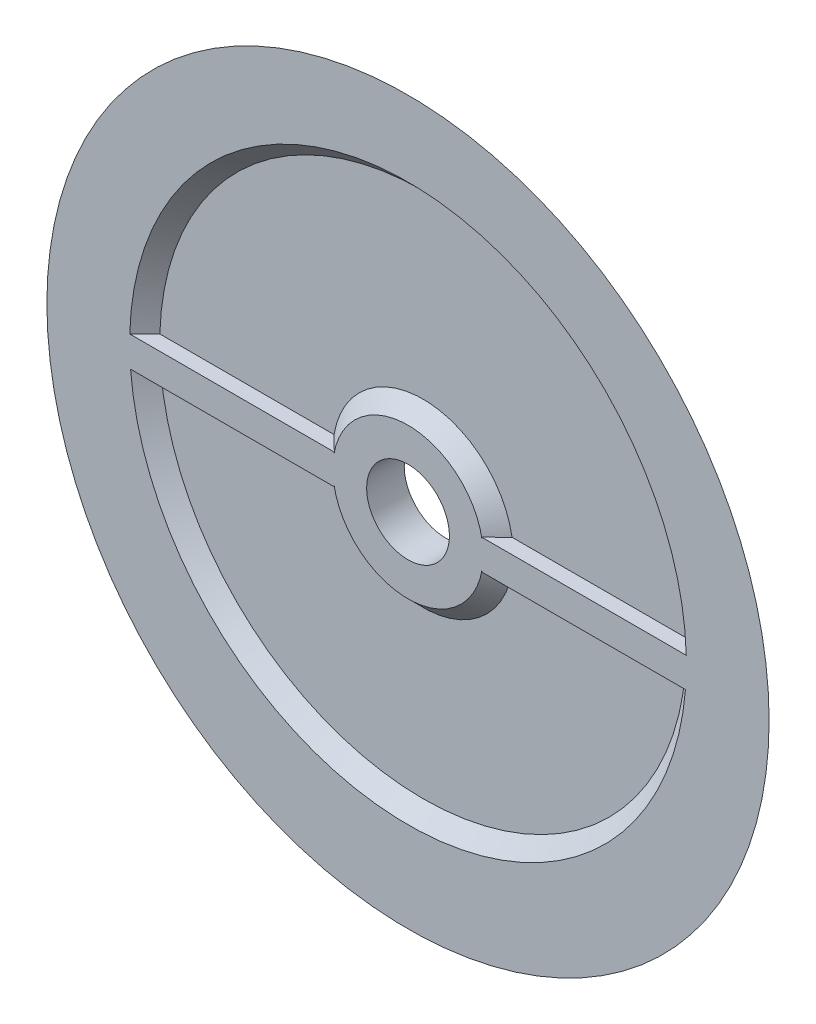
from build123d import *

# Parameters (mm, degrees)
SKETCH_1_R               = 37
EXTRUDE_1_DEPTH          = 5
SKETCH_4_R               = 34.4
SKETCH_4_R_2             = 30.4
EXTRUDE_2_DEPTH          = 0.8
SKETCH_5_R               = 5.5
CUT_EXTRUDE_1_DEPTH      = 69.066144301
SKETCH_6_R               = 37
SKETCH_6_R_2             = 10
CUT_EXTRUDE_2_DEPTH      = 2
CUT_EXTRUDE_2_DRAFT      = -45
SKETCH_7_W               = 25.320983541
SKETCH_7_H               = 4
EXTRUDE_3_DEPTH          = 2
SKETCH_9_W               = 2
SKETCH_9_H               = 4
EXTRUDE_5_DEPTH          = 5
PATTERN_CIRCULAR_1_COUNT = 2


with BuildPart() as part:
    # 스케치1 → 보스-돌출1 (new body)
    with BuildSketch(Plane.XY):
        Circle(SKETCH_1_R)
    extrude(amount=EXTRUDE_1_DEPTH)

    # 스케치3 → 회전1 (revolve)
    with BuildSketch(Plane(origin=(0, 0, 0), x_dir=(1, 0, 0), z_dir=(0, 1, 0))):
        Polygon((-37, -5), (-37, 0), (-48, -5), align=None)
    revolve(axis=Axis((0, 0, -6.462572401), (0, 0, 1)))

    # 스케치4 → 보스-돌출2 (add)
    with BuildSketch(Plane(origin=(0, 0, 0), x_dir=(-1, 0, 0), z_dir=(0, 0, -1))):
        Circle(SKETCH_4_R)
        Circle(SKETCH_4_R_2, mode=Mode.SUBTRACT)
    extrude(amount=EXTRUDE_2_DEPTH)

    # 스케치5 → 컷-돌출1 (cut, through all)
    with BuildSketch(Plane(origin=(0, 0, 0), x_dir=(-1, 0, 0), z_dir=(0, 0, -1))):
        Circle(SKETCH_5_R)
    extrude(amount=-CUT_EXTRUDE_1_DEPTH, mode=Mode.SUBTRACT)


with BuildPart() as cut_extrude_2_tool:
    # 스케치6 → 컷-돌출2 (with draft: the straight prism first)
    with BuildSketch(Plane.XY.offset(5)):
        with Locations((0, 0.990500037)):
            Circle(SKETCH_6_R)
        Circle(SKETCH_6_R_2, mode=Mode.SUBTRACT)
    extrude(amount=-CUT_EXTRUDE_2_DEPTH)
    # 컷-돌출2: the draft: its side faces are tilted about the plane it starts from
    cut_extrude_2_sides = [cut_extrude_2_tool.faces().sort_by_distance(p)[0] for p in [
        (-37, 0.990500037, 4),
        (-10, 0, 4),
    ]]
    draft(cut_extrude_2_sides, Plane.XY.offset(5), CUT_EXTRUDE_2_DRAFT)


with BuildPart() as part_1:
    add(part.part)

    # 컷-돌출2: cut by cut_extrude_2_tool
    add(cut_extrude_2_tool.part, mode=Mode.SUBTRACT)

    # 스케치7 → 보스-돌출3 (add)
    with BuildSketch(Plane.XY.offset(5)):
        with Locations((-27.526560518, 0)):
            Rectangle(SKETCH_7_W, SKETCH_7_H)
    extrude_3 = extrude(amount=-EXTRUDE_3_DEPTH)

    # 스케치9 → 보스-돌출5 (add)
    with BuildSketch(Plane(origin=(-14.866068747, 0, 0), x_dir=(0, 0, -1), z_dir=(1, 0, 0))):
        with Locations((-4, 0)):
            Rectangle(SKETCH_9_W, SKETCH_9_H)
    extrude_5 = extrude(amount=EXTRUDE_5_DEPTH)

    # 원형 패턴1: 보스-돌출3, 보스-돌출5 ×2 about axis
    pattern_circular_1_axis = Axis((0, 0, -37.34250157), (0, 0, 1))
    add([extrude_3.rotate(pattern_circular_1_axis, i * 360 / PATTERN_CIRCULAR_1_COUNT) for i in range(1, PATTERN_CIRCULAR_1_COUNT)])
    add([extrude_5.rotate(pattern_circular_1_axis, i * 360 / PATTERN_CIRCULAR_1_COUNT) for i in range(1, PATTERN_CIRCULAR_1_COUNT)])


solid = part_1.part
